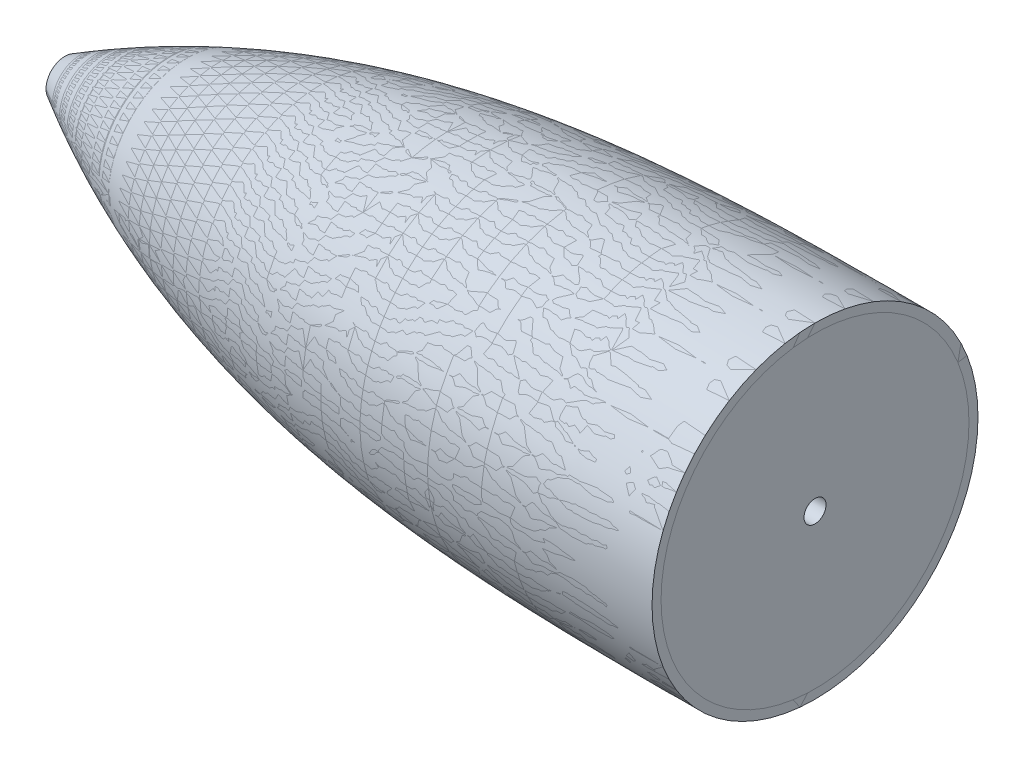
from build123d import *


# Read off the part's stored shape, not the designer's step: Rivoluzione2
with BuildPart() as part:
    # Schizzo3 → Rivoluzione1 (revolve)
    with BuildSketch(Plane.XY, mode=Mode.PRIVATE) as rivoluzione1_sk:
        with BuildLine():
            Line((2001.1, 506.136849405), (2414.2, 506.136849405))
            Line((2414.2, 506.136849405), (2414.2, 585.325339272))
            add(Edge.make_bspline(
                [(2001.1, 506.136849405), (2138.8, 585.646121488), (2276.5, 585.350081122), (2414.2, 585.325339272)],
                knots=[0.07354021, 0.07354021, 0.07354021, 0.07354021, 0.915776383, 0.915776383, 0.915776383, 0.915776383], degree=3))
        make_face()
    revolve(rivoluzione1_sk.sketch.rotate(Axis((1940.012799463, 500.036849405, 0), (1, 0, 0)), 90), axis=Axis((1940.012799463, 500.036849405, 0), (1, 0, 0)))


with BuildPart() as body_2:
    # Rivoluzione2 outline → Rivoluzione2 (revolve)
    with BuildSketch(Plane(origin=(0, 500.036849405, 0), x_dir=(0, 1, 0), z_dir=(0, 0, -1))):
        with BuildLine():
            Line((10.430016179, 2001.1), (10.430016179, 1998.599808029))
            add(Edge.make_bspline(
                [(10.430016179, 1998.599808029), (10.910686173, 1999.432267647), (11.389001598, 2000.265664939), (11.864962214, 2001.1)],
                knots=[0, 0, 0, 0, 0.006694905, 0.006694905, 0.006694905, 0.006694905], degree=3))
            Line((11.864962214, 2001.1), (10.430016179, 2001.1))
        make_face()
        Polygon((6.1, 2001.1), (10.430016179, 1998.599808029), (10.430016179, 2001.1), align=None)
        with BuildLine():
            Line((10.430016179, 2001.1), (11.864962214, 2001.1))
            add(Edge.make_bspline(
                [(11.864962214, 2001.1), (20.275621705, 2015.843463757), (27.950965963, 2030.879756216), (42.221068159, 2062.406548595), (48.729629696, 2078.931374991), (57.290840825, 2104.197146895), (59.944713987, 2112.698663775), (63.633925586, 2125.567063857), (65.405676356, 2132.030277364), (67.07013029, 2138.53622029), (68.156172047, 2142.882911625), (68.687595735, 2145.061820389), (73.358927674, 2164.686176447), (76.723264297, 2182.253606336), (81.889168192, 2215.986438927), (83.805224005, 2232.133888963), (85.288489867, 2248.349203732)],
                knots=[0.006694905, 0.006694905, 0.006694905, 0.006694905, 0.125, 0.125, 0.25, 0.25, 0.3125, 0.3125, 0.34375, 0.359375, 0.359375, 0.375, 0.375, 0.5, 0.5, 0.613621976, 0.613621976, 0.613621976, 0.613621976], degree=3))
            Line((85.288489867, 2248.349203732), (85.288489867, 2399.349565938))
            add(Edge.make_bspline(
                [(85.288489867, 2399.349565938), (85.232478335, 2269.146372295), (82.845286707, 2138.943178652), (10.430016179, 2008.739985009)],
                knots=[0.103817559, 0.103817559, 0.103817559, 0.103817559, 0.900199835, 0.900199835, 0.900199835, 0.900199835], degree=3))
            Line((10.430016179, 2008.739985009), (10.430016179, 2001.1))
        make_face()
        with BuildLine():
            add(Edge.make_bspline(
                [(10.430016179, 2008.739985009), (9.013636222, 2006.19332334), (7.570466344, 2003.64666167), (6.1, 2001.1)],
                knots=[0.900199835, 0.900199835, 0.900199835, 0.900199835, 0.915776383, 0.915776383, 0.915776383, 0.915776383], degree=3))
            Line((6.1, 2001.1), (10.430016179, 2001.1))
            Line((10.430016179, 2001.1), (10.430016179, 2008.739985009))
        make_face()
        with BuildLine():
            Line((85.288489867, 2399.349565938), (85.288489867, 2248.349203732))
            add(Edge.make_bspline(
                [(85.288489867, 2248.349203732), (85.437023057, 2249.972993834), (85.581216282, 2251.597464474), (86.490013213, 2262.149531122), (87.130446278, 2271.083855348), (88.19600693, 2288.954846707), (88.621294249, 2297.893329192), (90.132697646, 2337.728557137), (90.27548417, 2368.651513992), (90.288489786, 2399.578076944)],
                knots=[0.613621976, 0.613621976, 0.613621976, 0.613621976, 0.625, 0.625, 0.6875, 0.6875, 0.75, 0.75, 0.965962914, 0.965962914, 0.965962914, 0.965962914], degree=3))
            Line((90.288489786, 2399.578076944), (90.288489786, 2414.2))
            Line((90.288489786, 2414.2), (85.288489867, 2414.2))
            add(Edge.make_bspline(
                [(85.288489867, 2414.2), (85.289379306, 2409.249855313), (85.290619348, 2404.299710625), (85.288489867, 2399.349565938)],
                knots=[0.07354021, 0.07354021, 0.07354021, 0.07354021, 0.103817559, 0.103817559, 0.103817559, 0.103817559], degree=3))
        make_face()
        with BuildLine():
            Line((90.288489948, 2414.2), (90.288489786, 2399.578076944))
            add(Edge.make_bspline(
                [(90.288489786, 2399.578076944), (90.289329236, 2401.574237753), (90.289628008, 2403.570413584), (90.289628007, 2405.566597718)],
                knots=[0.965962914, 0.965962914, 0.965962914, 0.965962914, 0.979902281, 0.979902281, 0.979902281, 0.979902281], degree=3))
            add(Edge.make_bspline(
                [(90.289628007, 2405.566597718), (90.289628006, 2408.444387938), (90.289007052, 2411.322195412), (90.288489948, 2414.2)],
                knots=[0.979902281, 0.979902281, 0.979902281, 0.979902281, 0.999997909, 0.999997909, 0.999997909, 0.999997909], degree=3))
        make_face()
        with BuildLine():
            Line((85.288489867, 2414.2), (90.288489948, 2414.2))
            add(Edge.make_bspline(
                [(90.288489948, 2414.2), (90.288489894, 2414.200299466), (90.28848984, 2414.200598931), (90.288489786, 2414.200898397)],
                knots=[0.999997909, 0.999997909, 0.999997909, 0.999997909, 1, 1, 1, 1], degree=3))
            Line((90.288489786, 2414.200898397), (85.288489867, 2414.2))
        make_face()
    revolve(axis=Axis((0, 500.036849405, 0), (1, 0, 0)))


with BuildPart() as body_3:
    # Rivoluzione2 2 outline → Rivoluzione2 2 (revolve)
    with BuildSketch(Plane(origin=(0, 500.036849405, 0), x_dir=(0, 1, 0), z_dir=(0, 0, -1))):
        with BuildLine():
            add(Edge.make_bspline(
                [(90.288489786, 2414.200898397), (90.28848984, 2414.200598931), (90.288489894, 2414.200299466), (90.288489948, 2414.2)],
                knots=[0, 0, 0, 0, 2.095e-06, 2.095e-06, 2.095e-06, 2.095e-06], degree=3))
            Line((90.288489786, 2414.200898397), (85.288489867, 2414.2))
            Line((85.288489867, 2414.2), (90.288489948, 2414.2))
        make_face()
        with BuildLine():
            Line((90.288489786, 2399.609616402), (90.288489786, 2414.2))
            Line((90.288489786, 2414.2), (85.288489867, 2414.2))
            add(Edge.make_bspline(
                [(85.288489867, 2399.349565938), (85.290619348, 2404.299710625), (85.289379306, 2409.249855313), (85.288489867, 2414.2)],
                knots=[0.885499034, 0.885499034, 0.885499034, 0.885499034, 0.915776383, 0.915776383, 0.915776383, 0.915776383], degree=3))
            Line((85.288489867, 2399.349565938), (85.288489867, 2248.34889085))
            add(Edge.make_bspline(
                [(90.288489786, 2399.609616402), (90.275547382, 2368.740338676), (90.133521233, 2337.875794332), (88.294442963, 2289.206722838), (87.278084723, 2271.377235271), (85.601575112, 2251.827106665), (85.447545189, 2250.087906619), (85.288489867, 2248.34889085)],
                knots=[0.034028005, 0.034028005, 0.034028005, 0.034028005, 0.25, 0.25, 0.375, 0.375, 0.387207365, 0.387207365, 0.387207365, 0.387207365], degree=3))
        make_face()
        with BuildLine():
            add(Edge.make_bspline(
                [(90.288489948, 2414.2), (90.289005731, 2411.329540524), (90.289622909, 2408.459077331), (90.289622909, 2405.588636768)],
                knots=[2.095e-06, 2.095e-06, 2.095e-06, 2.095e-06, 0.020084367, 0.020084367, 0.020084367, 0.020084367], degree=3))
            Line((90.288489948, 2414.2), (90.288489786, 2399.609616402))
            add(Edge.make_bspline(
                [(90.289622909, 2405.588636768), (90.28962291, 2403.595616129), (90.289325377, 2401.602606401), (90.288489786, 2399.609616402)],
                knots=[0.020084367, 0.020084367, 0.020084367, 0.020084367, 0.034028005, 0.034028005, 0.034028005, 0.034028005], degree=3))
        make_face()
        with BuildLine():
            Line((85.288489867, 2248.34889085), (85.288489867, 2399.349565938))
            add(Edge.make_bspline(
                [(10.430016179, 2008.739985009), (82.845286707, 2138.943178652), (85.232478335, 2269.146372295), (85.288489867, 2399.349565938)],
                knots=[0.089116757, 0.089116757, 0.089116757, 0.089116757, 0.885499034, 0.885499034, 0.885499034, 0.885499034], degree=3))
            Line((10.430016179, 2008.739985009), (10.430016179, 2001.1))
            Line((10.430016179, 2001.1), (11.864976895, 2001.1))
            add(Edge.make_bspline(
                [(85.288489867, 2248.34889085), (85.040374706, 2245.636148064), (84.78003083, 2242.923853692), (84.058599338, 2235.761777857), (83.575568737, 2231.310811525), (82.017423875, 2217.98047571), (80.833258443, 2209.123048289), (76.793274392, 2182.649546593), (73.448516674, 2165.132546976), (67.274389936, 2139.09149066), (65.02387541, 2130.450139579), (61.34017978, 2117.550508147), (60.060883425, 2113.260704665), (57.397170041, 2104.703780942), (56.015589524, 2100.445758205), (48.856095954, 2079.259061737), (42.321217141, 2062.641541011), (31.278750314, 2038.225026659), (27.391678667, 2030.170967954), (21.251538977, 2018.217114026), (19.154065321, 2014.255372524), (15.324108018, 2007.231505173), (13.609302813, 2004.157655932), (11.864976895, 2001.1)],
                knots=[0.387207365, 0.387207365, 0.387207365, 0.387207365, 0.40625, 0.40625, 0.4375, 0.4375, 0.5, 0.5, 0.625, 0.625, 0.6875, 0.6875, 0.71875, 0.71875, 0.75, 0.75, 0.875, 0.875, 0.9375, 0.9375, 0.96875, 0.96875, 0.993299177, 0.993299177, 0.993299177, 0.993299177], degree=3))
        make_face()
        with BuildLine():
            Line((10.430016179, 2001.1), (10.430016179, 2008.739985009))
            add(Edge.make_bspline(
                [(6.1, 2001.1), (7.570466344, 2003.64666167), (9.013636222, 2006.19332334), (10.430016179, 2008.739985009)],
                knots=[0.07354021, 0.07354021, 0.07354021, 0.07354021, 0.089116757, 0.089116757, 0.089116757, 0.089116757], degree=3))
            Line((6.1, 2001.1), (10.430016179, 2001.1))
        make_face()
        with BuildLine():
            add(Edge.make_bspline(
                [(11.864976895, 2001.1), (11.388854237, 2000.265397214), (10.910532153, 1999.432000902), (10.430016179, 1998.599808029)],
                knots=[0.993299177, 0.993299177, 0.993299177, 0.993299177, 1, 1, 1, 1], degree=3))
            Line((11.864976895, 2001.1), (10.430016179, 2001.1))
            Line((10.430016179, 2001.1), (10.430016179, 1998.599808029))
        make_face()
        Polygon((10.430016179, 2001.1), (6.1, 2001.1), (10.430016179, 1998.599808029), align=None)
    revolve(axis=Axis((0, 500.036849405, 0), (1, 0, 0)))


solid = Compound([part.part, body_2.part, body_3.part])
